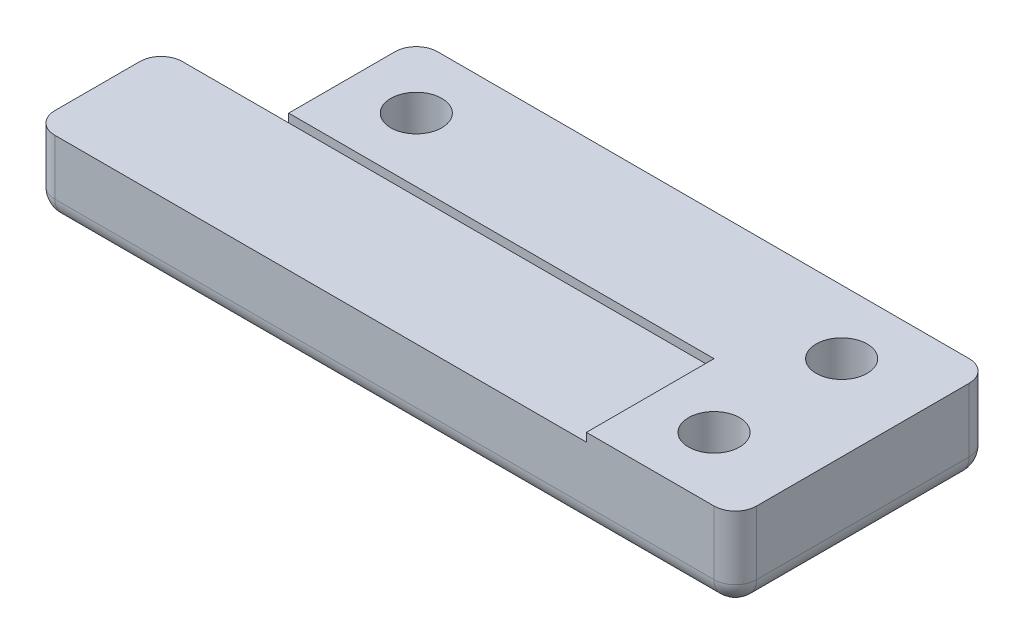
from build123d import *

# Parameters (mm, degrees)
EXTRUDE_1_DEPTH        = 4
CUT_EXTRUDE_START      = 2
CUT_EXTRUDE_2_DEPTH    = 2
CUT_EXTRUDE_3_DEPTH    = 2
SKETCH_4_R             = 1.2
CUT_EXTRUDE_4_DEPTH    = 22.260291625
FILLET_1_R             = 1
SKETCH_6_W             = 26
SKETCH_6_H             = 6
CUT_EXTRUDE_8_DEPTH    = 0.4
MIRROR_START           = 2
MIRROR_2_COPY_1_DEPTH  = 2
FILLET_1_OF_MIRROR_2_R = 1
SKETCH_8_W             = 60.520940054
SKETCH_8_H             = 38.044112249
CUT_EXTRUDE_10_DEPTH   = 26


with BuildPart() as part:
    # 草圖1 → 填料-伸長1 (new body)
    with BuildSketch(Plane(origin=(0, 0, 0), x_dir=(1, 0, 0), z_dir=(0, 1, 0))):
        Polygon((-13, -6), (20, -6), (20, 6), (-7, 6), (-7, 0), (-13, 0), align=None)
    extrude_1 = extrude(amount=EXTRUDE_1_DEPTH)

    # 草圖2 → 除料-伸長2 (cut)
    with BuildSketch(Plane(origin=(0, 0, 0), x_dir=(1, 0, 0), z_dir=(0, 1, 0)).offset(CUT_EXTRUDE_START)):
        Polygon((-1.59822288, 3), (-2.79911144, 5.08), (-5.20088856, 5.08), (-6.40177712, 3), (-5.20088856, 0.92), (-2.79911144, 0.92), align=None)
    cut_extrude_2 = extrude(amount=CUT_EXTRUDE_2_DEPTH, mode=Mode.SUBTRACT)

    # 草圖3 → 除料-伸長3 (cut)
    with BuildSketch(Plane(origin=(0, 0, 0), x_dir=(1, 0, 0), z_dir=(0, 1, 0)).offset(CUT_EXTRUDE_START)):
        Polygon((13.59822288, -3), (14.79911144, -5.08), (17.20088856, -5.08), (18.40177712, -3), (17.20088856, -0.92), (14.79911144, -0.92), align=None)
    cut_extrude_3 = extrude(amount=CUT_EXTRUDE_3_DEPTH, mode=Mode.SUBTRACT)

    # 草圖4 → 除料-伸長4 (cut, through all)
    with BuildSketch(Plane(origin=(0, 0, 0), x_dir=(1, 0, 0), z_dir=(0, 1, 0))):
        with Locations(Location((-4, 3, 0), (0, 0, 270))):
            Circle(SKETCH_4_R)
        with Locations(Location((16, 3, 0), (0, 0, 90))):
            Circle(SKETCH_4_R)
        with Locations(Location((16, -3, 0), (0, 0, 270))):
            Circle(SKETCH_4_R)
    cut_extrude_4 = extrude(amount=CUT_EXTRUDE_4_DEPTH, mode=Mode.SUBTRACT)

    # 圓角1
    # the kernel refuses this fillet: 1 mm, written as the material it takes off along each edge
    with BuildSketch(Plane(origin=(-6, 3, -5), x_dir=(0, 0, -1), z_dir=(0, 1, 0))) as fillet_1_piece_1_section:
        Polygon((0, 0), (FILLET_1_R, 0), (FILLET_1_R, FILLET_1_R), (0, FILLET_1_R), align=None)
    fillet_1_piece_1 = extrude(amount=FILLET_1_R, mode=Mode.PRIVATE)
    fillet_1_piece_1 = fillet_1_piece_1 - Plane(origin=(-6, 3, -5), x_dir=(0.7071067811865476, 0, 0.7071067811865474), z_dir=(0, 1, 0)) * Sphere(FILLET_1_R, mode=Mode.PRIVATE)
    add(fillet_1_piece_1, mode=Mode.SUBTRACT)
    with BuildSketch(Plane(origin=(-12, 3, 1), x_dir=(0, 1, 0), z_dir=(-1, 0, 0))) as fillet_1_piece_2_section:
        Polygon((0, 0), (FILLET_1_R, 0), (FILLET_1_R, FILLET_1_R), (0, FILLET_1_R), align=None)
    fillet_1_piece_2 = extrude(amount=FILLET_1_R, mode=Mode.PRIVATE)
    fillet_1_piece_2 = fillet_1_piece_2 - Plane(origin=(-12, 3, 1), x_dir=(0, -0.7071067811865475, 0.7071067811865475), z_dir=(-1, 0, 0)) * Sphere(FILLET_1_R, mode=Mode.PRIVATE)
    add(fillet_1_piece_2, mode=Mode.SUBTRACT)
    with BuildSketch(Plane(origin=(-12, 3, 5), x_dir=(-1, 0, 0), z_dir=(0, 0, 1))) as fillet_1_piece_3_section:
        Polygon((0, 0), (FILLET_1_R, 0), (FILLET_1_R, -FILLET_1_R), (0, -FILLET_1_R), align=None)
    fillet_1_piece_3 = extrude(amount=FILLET_1_R, mode=Mode.PRIVATE)
    fillet_1_piece_3 = fillet_1_piece_3 - Plane(origin=(-12, 3, 5), x_dir=(0.7071067811865475, -0.7071067811865475, 0), z_dir=(0, 0, 1)) * Sphere(FILLET_1_R, mode=Mode.PRIVATE)
    add(fillet_1_piece_3, mode=Mode.SUBTRACT)
    with BuildSketch(Plane(origin=(19, 3, 5), x_dir=(1, 0, 0), z_dir=(0, 0, 1))) as fillet_1_piece_4_section:
        Polygon((0, 0), (FILLET_1_R, 0), (FILLET_1_R, FILLET_1_R), (0, FILLET_1_R), align=None)
    fillet_1_piece_4 = extrude(amount=FILLET_1_R, mode=Mode.PRIVATE)
    fillet_1_piece_4 = fillet_1_piece_4 - Plane(origin=(19, 3, 5), x_dir=(-0.7071067811865475, -0.7071067811865475, 0), z_dir=(0, 0, 1)) * Sphere(FILLET_1_R, mode=Mode.PRIVATE)
    add(fillet_1_piece_4, mode=Mode.SUBTRACT)
    with BuildSketch(Plane(origin=(19, 3, -5), x_dir=(0, 1, 0), z_dir=(1, 0, 0))) as fillet_1_piece_5_section:
        Polygon((0, 0), (FILLET_1_R, 0), (FILLET_1_R, -FILLET_1_R), (0, -FILLET_1_R), align=None)
    fillet_1_piece_5 = extrude(amount=FILLET_1_R, mode=Mode.PRIVATE)
    fillet_1_piece_5 = fillet_1_piece_5 - Plane(origin=(19, 3, -5), x_dir=(0, -0.7071067811865475, 0.7071067811865475), z_dir=(1, 0, 0)) * Sphere(FILLET_1_R, mode=Mode.PRIVATE)
    add(fillet_1_piece_5, mode=Mode.SUBTRACT)
    with BuildSketch(Plane(origin=(-7, 4, -5), x_dir=(1, 0, 0), z_dir=(0, 0, 1)), Plane(origin=(-7, 4, 0), x_dir=(0, 0, 1), z_dir=(-1, 0, 0))) as fillet_1_piece_6:
        with BuildLine():
            CenterArc((FILLET_1_R, -FILLET_1_R), FILLET_1_R, 90, 90)
            Line((0, -FILLET_1_R), (0, 0))
            Line((0, 0), (FILLET_1_R, 0))
        make_face()
    extrude(amount=5, mode=Mode.SUBTRACT)
    with BuildSketch(Plane(origin=(-13, 4, 1), x_dir=(0, -1, 0), z_dir=(0, 0, 1))) as fillet_1_piece_7:
        with BuildLine():
            CenterArc((FILLET_1_R, FILLET_1_R), FILLET_1_R, 180, 90)
            Line((0, FILLET_1_R), (0, 0))
            Line((0, 0), (FILLET_1_R, 0))
        make_face()
    extrude(amount=4, mode=Mode.SUBTRACT)
    with BuildSketch(Plane(origin=(-12, 4, 6), x_dir=(0, -1, 0), z_dir=(1, 0, 0))) as fillet_1_piece_8:
        with BuildLine():
            CenterArc((FILLET_1_R, FILLET_1_R), FILLET_1_R, 180, 90)
            Line((0, FILLET_1_R), (0, 0))
            Line((0, 0), (FILLET_1_R, 0))
        make_face()
    extrude(amount=31, mode=Mode.SUBTRACT)
    with BuildSketch(Plane(origin=(20, 4, 5), x_dir=(0, -1, 0), z_dir=(0, 0, -1))) as fillet_1_piece_9:
        with BuildLine():
            CenterArc((FILLET_1_R, FILLET_1_R), FILLET_1_R, 180, 90)
            Line((0, FILLET_1_R), (0, 0))
            Line((0, 0), (FILLET_1_R, 0))
        make_face()
    extrude(amount=10, mode=Mode.SUBTRACT)
    with BuildSketch(Plane(origin=(19, 4, -6), x_dir=(0, 0, 1), z_dir=(-1, 0, 0))) as fillet_1_piece_10:
        with BuildLine():
            CenterArc((FILLET_1_R, -FILLET_1_R), FILLET_1_R, 90, 90)
            Line((0, -FILLET_1_R), (0, 0))
            Line((0, 0), (FILLET_1_R, 0))
        make_face()
    extrude(amount=25, mode=Mode.SUBTRACT)
    with BuildSketch(Plane(origin=(-13, -2.5, 0), x_dir=(0, 0, 1), z_dir=(0, 1, 0)), Plane(origin=(-13, -2.5, 6), x_dir=(1, 0, 0), z_dir=(0, 1, 0))) as fillet_1_piece_11:
        with BuildLine():
            CenterArc((FILLET_1_R, FILLET_1_R), FILLET_1_R, 180, 90)
            Line((0, FILLET_1_R), (0, 0))
            Line((0, 0), (FILLET_1_R, 0))
        make_face()
    extrude(amount=5.5, mode=Mode.SUBTRACT)
    with BuildSketch(Plane(origin=(20, -2.5, 6), x_dir=(-1, 0, 0), z_dir=(0, 1, 0)), Plane(origin=(20, -2.5, -6), x_dir=(0, 0, 1), z_dir=(0, 1, 0)), Plane(origin=(-7, -2.5, -6), x_dir=(1, 0, 0), z_dir=(0, 1, 0))) as fillet_1_piece_12:
        with BuildLine():
            CenterArc((FILLET_1_R, -FILLET_1_R), FILLET_1_R, 90, 90)
            Line((0, -FILLET_1_R), (0, 0))
            Line((0, 0), (FILLET_1_R, 0))
        make_face()
    extrude(amount=5.5, mode=Mode.SUBTRACT)
    with BuildSketch(Plane(origin=(-4.5, 4, 0), x_dir=(0, 0, 1), z_dir=(-1, 0, 0))) as fillet_1_piece_13a_section:
        with BuildLine():
            CenterArc((FILLET_1_R, -FILLET_1_R), FILLET_1_R, 90, 90)
            Line((0, -FILLET_1_R), (0, 0))
            Line((0, 0), (FILLET_1_R, 0))
        make_face()
    fillet_1_piece_13a = extrude(amount=7.5, mode=Mode.PRIVATE)
    fillet_1_piece_13a = split(fillet_1_piece_13a, bisect_by=Plane(origin=(-7, 3.773604886, 0.226395114), z_dir=(1, 0, 0)), keep=Keep.TOP, mode=Mode.PRIVATE)
    with BuildSketch(Plane(origin=(-7, 4, -5), x_dir=(1, 0, 0), z_dir=(0, 0, 1))) as fillet_1_piece_13b_section:
        with BuildLine():
            CenterArc((FILLET_1_R, -FILLET_1_R), FILLET_1_R, 90, 90)
            Line((0, -FILLET_1_R), (0, 0))
            Line((0, 0), (FILLET_1_R, 0))
        make_face()
    fillet_1_piece_13b = extrude(amount=7.5, mode=Mode.PRIVATE)
    fillet_1_piece_13b = split(fillet_1_piece_13b, bisect_by=Plane(origin=(-6.773604886, 3.773604886, 0), z_dir=(0, 0, 1)), keep=Keep.TOP, mode=Mode.PRIVATE)
    fillet_1_piece_13 = fillet_1_piece_13a & fillet_1_piece_13b
    add(fillet_1_piece_13, mode=Mode.SUBTRACT)

    # 草圖6 → 除料-伸長8 (cut)
    with BuildSketch(Plane(origin=(0, 0, 0), x_dir=(1, 0, 0), z_dir=(0, 1, 0))):
        with Locations((0, -3)):
            Rectangle(SKETCH_6_W, SKETCH_6_H)
    cut_extrude_8 = extrude(amount=CUT_EXTRUDE_8_DEPTH, mode=Mode.SUBTRACT)

    # 鏡射3: 除料-伸長3 across plane
    add(cut_extrude_3.mirror(Plane(origin=(-7, 4, 0), x_dir=(1, 0, 0), z_dir=(0, 0, 1))), mode=Mode.SUBTRACT)

    # 鏡射2: 填料-伸長1, 除料-伸長2, 除料-伸長3, 除料-伸長4, 除料-伸長8 across plane
    add(extrude_1.mirror(Plane.ZX))
    add(cut_extrude_2.mirror(Plane.ZX), mode=Mode.SUBTRACT)
    add(cut_extrude_3.mirror(Plane.ZX), mode=Mode.SUBTRACT)
    add(cut_extrude_4.mirror(Plane.ZX), mode=Mode.SUBTRACT)
    add(cut_extrude_8.mirror(Plane.ZX), mode=Mode.SUBTRACT)

    # 鏡射2 copy 1 sketch → 鏡射2 copy 1 (cut)
    with BuildSketch(Plane.XZ.offset(MIRROR_START)):
        Polygon((13.59822288, -3), (14.79911144, -5.08), (17.20088856, -5.08), (18.40177712, -3), (17.20088856, -0.92), (14.79911144, -0.92), align=None)
    extrude(amount=MIRROR_2_COPY_1_DEPTH, mode=Mode.SUBTRACT)

    # 圓角1 of 鏡射2
    # the kernel refuses this fillet: 1 mm, written as the material it takes off along each edge
    with BuildSketch(Plane(origin=(-6, -3, -5), x_dir=(0, -1, 0), z_dir=(-1, 0, 0))) as fillet_1_of_mirror_2_piece_1_section:
        Polygon((0, 0), (FILLET_1_OF_MIRROR_2_R, 0), (FILLET_1_OF_MIRROR_2_R, -FILLET_1_OF_MIRROR_2_R), (0, -FILLET_1_OF_MIRROR_2_R), align=None)
    fillet_1_of_mirror_2_piece_1 = extrude(amount=FILLET_1_OF_MIRROR_2_R, mode=Mode.PRIVATE)
    fillet_1_of_mirror_2_piece_1 = fillet_1_of_mirror_2_piece_1 - Plane(origin=(-6, -3, -5), x_dir=(0, 0.7071067811865475, 0.7071067811865475), z_dir=(-1, 0, 0)) * Sphere(FILLET_1_OF_MIRROR_2_R, mode=Mode.PRIVATE)
    add(fillet_1_of_mirror_2_piece_1, mode=Mode.SUBTRACT)
    with BuildSketch(Plane(origin=(-12, -3, 1), x_dir=(0, -1, 0), z_dir=(0, 0, -1))) as fillet_1_of_mirror_2_piece_2_section:
        Polygon((0, 0), (FILLET_1_OF_MIRROR_2_R, 0), (FILLET_1_OF_MIRROR_2_R, FILLET_1_OF_MIRROR_2_R), (0, FILLET_1_OF_MIRROR_2_R), align=None)
    fillet_1_of_mirror_2_piece_2 = extrude(amount=FILLET_1_OF_MIRROR_2_R, mode=Mode.PRIVATE)
    fillet_1_of_mirror_2_piece_2 = fillet_1_of_mirror_2_piece_2 - Plane(origin=(-12, -3, 1), x_dir=(0.7071067811865475, 0.7071067811865475, 0), z_dir=(0, 0, -1)) * Sphere(FILLET_1_OF_MIRROR_2_R, mode=Mode.PRIVATE)
    add(fillet_1_of_mirror_2_piece_2, mode=Mode.SUBTRACT)
    with BuildSketch(Plane(origin=(-12, -3, 5), x_dir=(0, -1, 0), z_dir=(0, 0, 1))) as fillet_1_of_mirror_2_piece_3_section:
        Polygon((0, 0), (FILLET_1_OF_MIRROR_2_R, 0), (FILLET_1_OF_MIRROR_2_R, -FILLET_1_OF_MIRROR_2_R), (0, -FILLET_1_OF_MIRROR_2_R), align=None)
    fillet_1_of_mirror_2_piece_3 = extrude(amount=FILLET_1_OF_MIRROR_2_R, mode=Mode.PRIVATE)
    fillet_1_of_mirror_2_piece_3 = fillet_1_of_mirror_2_piece_3 - Plane(origin=(-12, -3, 5), x_dir=(0.7071067811865475, 0.7071067811865475, 0), z_dir=(0, 0, 1)) * Sphere(FILLET_1_OF_MIRROR_2_R, mode=Mode.PRIVATE)
    add(fillet_1_of_mirror_2_piece_3, mode=Mode.SUBTRACT)
    with BuildSketch(Plane(origin=(19, -3, 5), x_dir=(1, 0, 0), z_dir=(0, 0, 1))) as fillet_1_of_mirror_2_piece_4_section:
        Polygon((0, 0), (FILLET_1_OF_MIRROR_2_R, 0), (FILLET_1_OF_MIRROR_2_R, -FILLET_1_OF_MIRROR_2_R), (0, -FILLET_1_OF_MIRROR_2_R), align=None)
    fillet_1_of_mirror_2_piece_4 = extrude(amount=FILLET_1_OF_MIRROR_2_R, mode=Mode.PRIVATE)
    fillet_1_of_mirror_2_piece_4 = fillet_1_of_mirror_2_piece_4 - Plane(origin=(19, -3, 5), x_dir=(-0.7071067811865475, 0.7071067811865475, 0), z_dir=(0, 0, 1)) * Sphere(FILLET_1_OF_MIRROR_2_R, mode=Mode.PRIVATE)
    add(fillet_1_of_mirror_2_piece_4, mode=Mode.SUBTRACT)
    with BuildSketch(Plane(origin=(19, -3, -5), x_dir=(0, -1, 0), z_dir=(1, 0, 0))) as fillet_1_of_mirror_2_piece_5_section:
        Polygon((0, 0), (FILLET_1_OF_MIRROR_2_R, 0), (FILLET_1_OF_MIRROR_2_R, FILLET_1_OF_MIRROR_2_R), (0, FILLET_1_OF_MIRROR_2_R), align=None)
    fillet_1_of_mirror_2_piece_5 = extrude(amount=FILLET_1_OF_MIRROR_2_R, mode=Mode.PRIVATE)
    fillet_1_of_mirror_2_piece_5 = fillet_1_of_mirror_2_piece_5 - Plane(origin=(19, -3, -5), x_dir=(0, 0.7071067811865475, 0.7071067811865475), z_dir=(1, 0, 0)) * Sphere(FILLET_1_OF_MIRROR_2_R, mode=Mode.PRIVATE)
    add(fillet_1_of_mirror_2_piece_5, mode=Mode.SUBTRACT)
    with BuildSketch(Plane(origin=(-7, -4, -5), x_dir=(1, 0, 0), z_dir=(0, 0, 1)), Plane(origin=(-7, -4, 0), x_dir=(0, 0, 1), z_dir=(-1, 0, 0))) as fillet_1_of_mirror_2_piece_6:
        with BuildLine():
            CenterArc((FILLET_1_OF_MIRROR_2_R, FILLET_1_OF_MIRROR_2_R), FILLET_1_OF_MIRROR_2_R, 180, 90)
            Line((0, FILLET_1_OF_MIRROR_2_R), (0, 0))
            Line((0, 0), (FILLET_1_OF_MIRROR_2_R, 0))
        make_face()
    extrude(amount=5, mode=Mode.SUBTRACT)
    with BuildSketch(Plane(origin=(-13, -4, 1), x_dir=(1, 0, 0), z_dir=(0, 0, 1))) as fillet_1_of_mirror_2_piece_7:
        with BuildLine():
            CenterArc((FILLET_1_OF_MIRROR_2_R, FILLET_1_OF_MIRROR_2_R), FILLET_1_OF_MIRROR_2_R, 180, 90)
            Line((0, FILLET_1_OF_MIRROR_2_R), (0, 0))
            Line((0, 0), (FILLET_1_OF_MIRROR_2_R, 0))
        make_face()
    extrude(amount=4, mode=Mode.SUBTRACT)
    with BuildSketch(Plane(origin=(-12, -4, 6), x_dir=(0, 1, 0), z_dir=(1, 0, 0))) as fillet_1_of_mirror_2_piece_8:
        with BuildLine():
            CenterArc((FILLET_1_OF_MIRROR_2_R, -FILLET_1_OF_MIRROR_2_R), FILLET_1_OF_MIRROR_2_R, 90, 90)
            Line((0, -FILLET_1_OF_MIRROR_2_R), (0, 0))
            Line((0, 0), (FILLET_1_OF_MIRROR_2_R, 0))
        make_face()
    extrude(amount=31, mode=Mode.SUBTRACT)
    with BuildSketch(Plane(origin=(20, -4, 5), x_dir=(0, 1, 0), z_dir=(0, 0, -1))) as fillet_1_of_mirror_2_piece_9:
        with BuildLine():
            CenterArc((FILLET_1_OF_MIRROR_2_R, -FILLET_1_OF_MIRROR_2_R), FILLET_1_OF_MIRROR_2_R, 90, 90)
            Line((0, -FILLET_1_OF_MIRROR_2_R), (0, 0))
            Line((0, 0), (FILLET_1_OF_MIRROR_2_R, 0))
        make_face()
    extrude(amount=10, mode=Mode.SUBTRACT)
    with BuildSketch(Plane(origin=(19, -4, -6), x_dir=(0, 0, 1), z_dir=(-1, 0, 0))) as fillet_1_of_mirror_2_piece_10:
        with BuildLine():
            CenterArc((FILLET_1_OF_MIRROR_2_R, FILLET_1_OF_MIRROR_2_R), FILLET_1_OF_MIRROR_2_R, 180, 90)
            Line((0, FILLET_1_OF_MIRROR_2_R), (0, 0))
            Line((0, 0), (FILLET_1_OF_MIRROR_2_R, 0))
        make_face()
    extrude(amount=25, mode=Mode.SUBTRACT)
    with BuildSketch(Plane(origin=(-13, 2.1, 0), x_dir=(0, 0, 1), z_dir=(0, -1, 0)), Plane(origin=(-13, 2.1, 6), x_dir=(1, 0, 0), z_dir=(0, -1, 0))) as fillet_1_of_mirror_2_piece_11:
        with BuildLine():
            CenterArc((FILLET_1_OF_MIRROR_2_R, -FILLET_1_OF_MIRROR_2_R), FILLET_1_OF_MIRROR_2_R, 90, 90)
            Line((0, -FILLET_1_OF_MIRROR_2_R), (0, 0))
            Line((0, 0), (FILLET_1_OF_MIRROR_2_R, 0))
        make_face()
    extrude(amount=5.1, mode=Mode.SUBTRACT)
    with BuildSketch(Plane(origin=(20, 2.5, 6), x_dir=(-1, 0, 0), z_dir=(0, -1, 0)), Plane(origin=(20, 2.5, -6), x_dir=(0, 0, 1), z_dir=(0, -1, 0)), Plane(origin=(-7, 2.5, -6), x_dir=(1, 0, 0), z_dir=(0, -1, 0))) as fillet_1_of_mirror_2_piece_12:
        with BuildLine():
            CenterArc((FILLET_1_OF_MIRROR_2_R, FILLET_1_OF_MIRROR_2_R), FILLET_1_OF_MIRROR_2_R, 180, 90)
            Line((0, FILLET_1_OF_MIRROR_2_R), (0, 0))
            Line((0, 0), (FILLET_1_OF_MIRROR_2_R, 0))
        make_face()
    extrude(amount=5.5, mode=Mode.SUBTRACT)
    with BuildSketch(Plane(origin=(-4.5, -4, 0), x_dir=(0, 0, 1), z_dir=(-1, 0, 0))) as fillet_1_of_mirror_2_piece_13a_section:
        with BuildLine():
            CenterArc((FILLET_1_OF_MIRROR_2_R, FILLET_1_OF_MIRROR_2_R), FILLET_1_OF_MIRROR_2_R, 180, 90)
            Line((0, FILLET_1_OF_MIRROR_2_R), (0, 0))
            Line((0, 0), (FILLET_1_OF_MIRROR_2_R, 0))
        make_face()
    fillet_1_of_mirror_2_piece_13a = extrude(amount=7.5, mode=Mode.PRIVATE)
    fillet_1_of_mirror_2_piece_13a = split(fillet_1_of_mirror_2_piece_13a, bisect_by=Plane(origin=(-7, -3.773604886, 0.226395114), z_dir=(1, 0, 0)), keep=Keep.TOP, mode=Mode.PRIVATE)
    with BuildSketch(Plane(origin=(-7, -4, -5), x_dir=(1, 0, 0), z_dir=(0, 0, 1))) as fillet_1_of_mirror_2_piece_13b_section:
        with BuildLine():
            CenterArc((FILLET_1_OF_MIRROR_2_R, FILLET_1_OF_MIRROR_2_R), FILLET_1_OF_MIRROR_2_R, 180, 90)
            Line((0, FILLET_1_OF_MIRROR_2_R), (0, 0))
            Line((0, 0), (FILLET_1_OF_MIRROR_2_R, 0))
        make_face()
    fillet_1_of_mirror_2_piece_13b = extrude(amount=7.5, mode=Mode.PRIVATE)
    fillet_1_of_mirror_2_piece_13b = split(fillet_1_of_mirror_2_piece_13b, bisect_by=Plane(origin=(-6.773604886, -3.773604886, 0), z_dir=(0, 0, 1)), keep=Keep.TOP, mode=Mode.PRIVATE)
    fillet_1_of_mirror_2_piece_13 = fillet_1_of_mirror_2_piece_13a & fillet_1_of_mirror_2_piece_13b
    add(fillet_1_of_mirror_2_piece_13, mode=Mode.SUBTRACT)

    # 草圖8 → 除料-伸長10 (cut)
    with BuildSketch(Plane(origin=(0, 0, 0), x_dir=(1, 0, 0), z_dir=(0, 1, 0))):
        with Locations((-0.399313798, 3.851597451)):
            Rectangle(SKETCH_8_W, SKETCH_8_H)
    extrude(amount=CUT_EXTRUDE_10_DEPTH, mode=Mode.SUBTRACT)


solid = part.part
